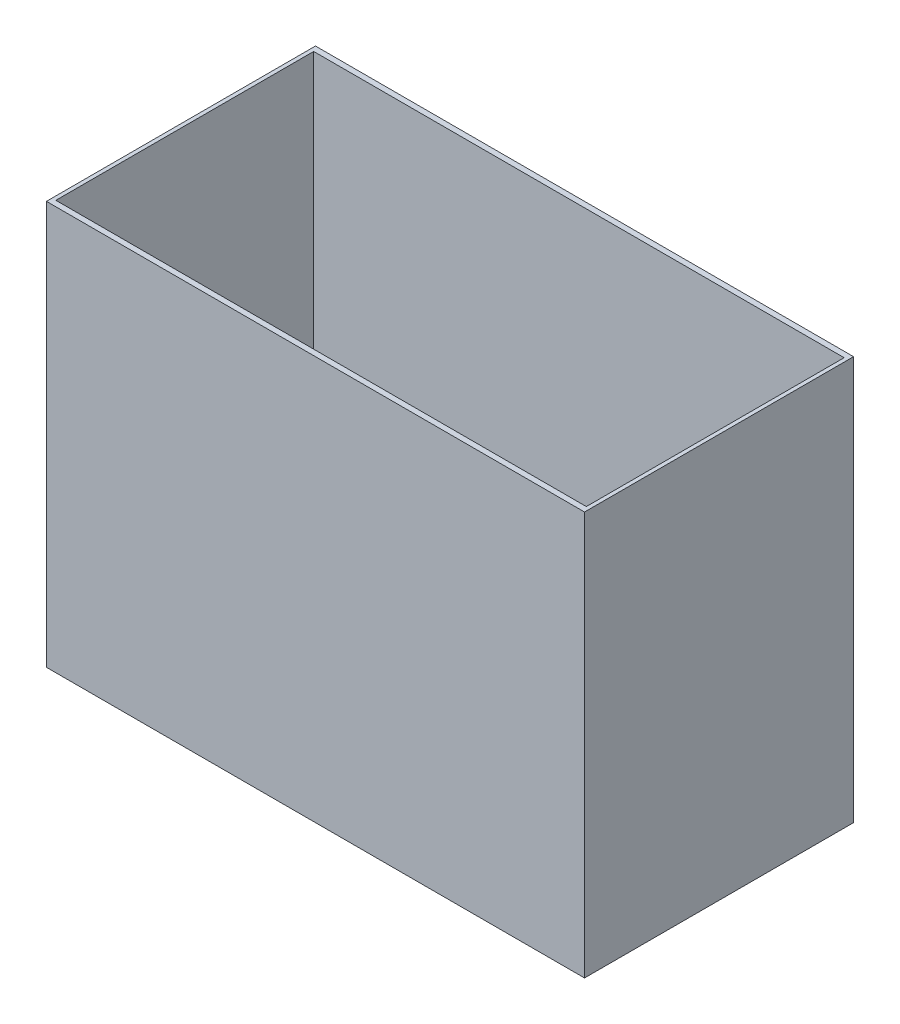
from build123d import *

# Parameters (mm, degrees)
SKETCH1_W           = 584.2
SKETCH1_H           = 279.4
BOSS_EXTRUDE1_DEPTH = 12.7
SKETCH3_W           = 609.6
SKETCH3_H           = 304.8
SKETCH3_W_2         = 600.964
SKETCH3_H_2         = 292.1
BOSS_EXTRUDE3_DEPTH = 457.2
SKETCH4_R           = 2.778125
CUT_EXTRUDE1_DEPTH  = 561.097357608


with BuildPart() as part:
    # Sketch1 → Boss-Extrude1 (new body)
    with BuildSketch(Plane(origin=(0, 0, 0), x_dir=(1, 0, 0), z_dir=(0, 1, 0))):
        Rectangle(SKETCH1_W, SKETCH1_H)
    extrude(amount=BOSS_EXTRUDE1_DEPTH)

    # Sketch4 → Cut-Extrude1 (cut, through all)
    with BuildSketch(Plane(origin=(0, 12.7, 0), x_dir=(1, 0, 0), z_dir=(0, 1, 0))):
        with Locations((273.05, 120.65)):
            Circle(SKETCH4_R)
    cut_extrude1 = extrude(amount=-CUT_EXTRUDE1_DEPTH, mode=Mode.SUBTRACT)

    # Mirror1: Cut-Extrude1 across plane
    add(cut_extrude1.mirror(Plane.XY), mode=Mode.SUBTRACT)


with BuildPart() as body_2:
    # Sketch3 → Boss-Extrude3 (new body)
    with BuildSketch(Plane(origin=(0, 0, 0), x_dir=(1, 0, 0), z_dir=(0, 1, 0))):
        Rectangle(SKETCH3_W, SKETCH3_H)
        Rectangle(SKETCH3_W_2, SKETCH3_H_2, mode=Mode.SUBTRACT)
    extrude(amount=BOSS_EXTRUDE3_DEPTH)


solid = Compound([part.part, body_2.part])
